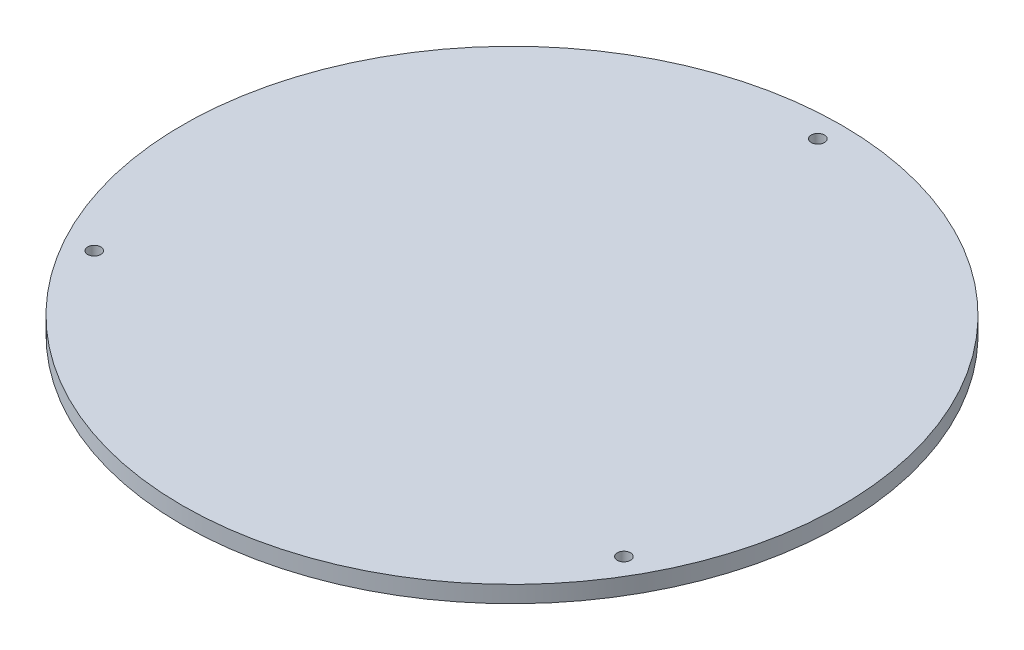
from build123d import *

# Parameters (mm, degrees)
SKETCH1_R               = 125
BOSS_EXTRUDE1_DEPTH     = 6.35
SKETCH2_R               = 2.5
CUT_EXTRUDE1_DEPTH      = 177.890707783
SKETCH4_W               = 1
SKETCH4_H               = 10
SKETCH4_H_2             = 40
SKETCH4_W_2             = 10
SKETCH4_H_3             = 1
CUT_EXTRUDE_THIN1_DEPTH = 1


with BuildPart() as part:
    # Sketch1 → Boss-Extrude1 (new body)
    with BuildSketch(Plane(origin=(0, 0, 0), x_dir=(1, 0, 0), z_dir=(0, 1, 0))):
        Circle(SKETCH1_R)
    extrude(amount=BOSS_EXTRUDE1_DEPTH)

    # Sketch2 → Cut-Extrude1 (cut, through all)
    with BuildSketch(Plane(origin=(0, 6.35, 0), x_dir=(1, 0, 0), z_dir=(0, 1, 0))):
        with Locations((0, 116)):
            Circle(SKETCH2_R)
        with Locations((100.458946839, -58)):
            Circle(SKETCH2_R)
        with Locations((-100.458946839, -58)):
            Circle(SKETCH2_R)
    extrude(amount=-CUT_EXTRUDE1_DEPTH, mode=Mode.SUBTRACT)

    # Sketch4 → Cut-Extrude-Thin1 (cut)
    with BuildSketch(Plane.XZ):
        Rectangle(SKETCH4_W, SKETCH4_H)
        with BuildLine():
            Line((-20, 20.5), (-25, 20.5))
            ThreePointArc((-25, 20.5), (-35.5, 10), (-25, -0.5))
            Line((-25, -0.5), (-20, -0.5))
            Line((-20, -0.5), (-20, 0.5))
            Line((-20, 0.5), (-25, 0.5))
            ThreePointArc((-25, 0.5), (-34.5, 10), (-25, 19.5))
            Line((-25, 19.5), (-20, 19.5))
            Line((-20, 19.5), (-20, 20.5))
        make_face()
        with Locations((-15, 0)):
            Rectangle(SKETCH4_W, SKETCH4_H_2)
        Rectangle(SKETCH4_W_2, SKETCH4_H_3)
        Polygon((35.5, -20), (35.5, 21.651387819), (25, 5.901387819), (14.5, 21.651387819), (14.5, -20), (15.5, -20), (15.5, 18.348612181), (25, 4.098612181), (34.5, 18.348612181), (34.5, -20), align=None)
    extrude(amount=-CUT_EXTRUDE_THIN1_DEPTH, mode=Mode.SUBTRACT)


solid = part.part
